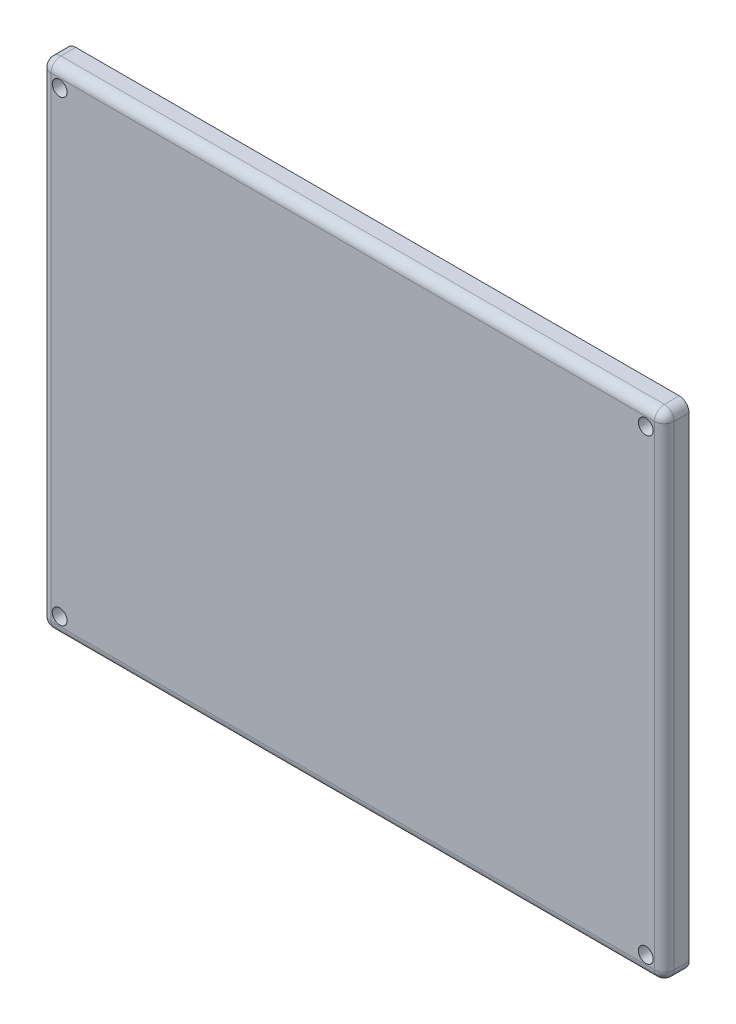
from build123d import *

# Parameters (mm, degrees)
SKETCH1_W                        = 160.02
SKETCH1_H                        = 127
BOSS_EXTRUDE1_DEPTH              = 6.35
FILLET1_R                        = 2.54
SHELL1_START                     = 2.54
SHELL1_OUTLINE_W                 = 121.92
SHELL1_OUTLINE_H                 = 3.81
SHELL1_DEPTH                     = 154.94
CHAMFER1_SIZE                    = 10.16
F_9_64_0_15_DIAMETER_HOLE1_D     = 3.81
F_9_64_0_15_DIAMETER_HOLE1_DEPTH = 6.35
F_9_64_0_15_DIAMETER_HOLE1_TIP   = 1.144639479


# Read off the part's stored shape, not the designer's step: Shell1
with BuildPart() as part:
    # Sketch1 → Boss-Extrude1 (new body)
    with BuildSketch(Plane.XY):
        with Locations((80.01, -63.5)):
            Rectangle(SKETCH1_W, SKETCH1_H)
    extrude(amount=BOSS_EXTRUDE1_DEPTH)

    # Fillet1
    fillet1_edges = [part.edges().sort_by_distance(p)[0] for p in [
        (160.02, -63.5, 6.35),
        (80.01, 0, 6.35),
        (0, -63.5, 6.35),
        (0, 0, 3.175),
        (160.02, 0, 3.175),
        (160.02, -127, 3.175),
        (0, -127, 3.175),
        (80.01, -127, 6.35),
    ]]
    fillet(fillet1_edges, radius=FILLET1_R)

    # Shell1 outline → Shell1 (cut)
    with BuildSketch(Plane.YZ.offset(SHELL1_START)):
        with Locations((-63.5, 1.905)):
            Rectangle(SHELL1_OUTLINE_W, SHELL1_OUTLINE_H)
    extrude(amount=SHELL1_DEPTH, mode=Mode.SUBTRACT)

    # Chamfer1
    chamfer1_edges = [part.edges().sort_by_distance(p)[0] for p in [
        (2.54, -2.54, 1.905),
        (2.54, -124.46, 1.905),
        (157.48, -124.46, 1.905),
        (157.48, -2.54, 1.905),
    ]]
    chamfer(chamfer1_edges, length=CHAMFER1_SIZE)

    # 9/64 (0.15) Diameter Hole1
    with Locations(Plane(origin=(0, 0, 0), x_dir=(-1, 0, 0), z_dir=(0, 0, -1))):
        with Locations((-155.2575, -4.7625), (-4.7625, -4.7625), (-4.7625, -122.2375), (-155.2575, -122.2375)):
            Hole(F_9_64_0_15_DIAMETER_HOLE1_D / 2, depth=F_9_64_0_15_DIAMETER_HOLE1_DEPTH)
            with Locations((0, 0, -(F_9_64_0_15_DIAMETER_HOLE1_DEPTH + F_9_64_0_15_DIAMETER_HOLE1_TIP / 2))):  # 118° drill point
                Cone(0, F_9_64_0_15_DIAMETER_HOLE1_D / 2, F_9_64_0_15_DIAMETER_HOLE1_TIP, mode=Mode.SUBTRACT)


solid = part.part
